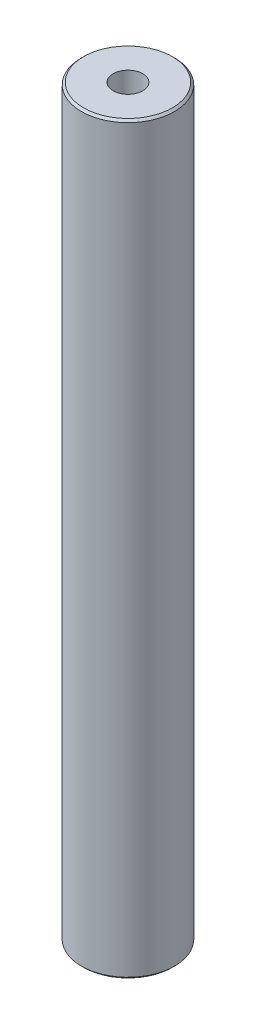
from build123d import *

# Parameters (mm, degrees)
SKETCH1_R           = 37.5
BOSS_EXTRUDE1_DEPTH = 600
SKETCH2_R           = 11.945109462
CUT_EXTRUDE1_DEPTH  = 603.339190158
CHAMFER1_SIZE       = 1.717310467


with BuildPart() as part:
    # Sketch1 → Boss-Extrude1 (new body)
    with BuildSketch(Plane(origin=(0, 0, 0), x_dir=(1, 0, 0), z_dir=(0, 1, 0))):
        Circle(SKETCH1_R)
    extrude(amount=BOSS_EXTRUDE1_DEPTH)

    # Sketch2 → Cut-Extrude1 (cut, through all)
    with BuildSketch(Plane(origin=(0, 0, 0), x_dir=(1, 0, 0), z_dir=(0, 1, 0))):
        Circle(SKETCH2_R)
    extrude(amount=CUT_EXTRUDE1_DEPTH, mode=Mode.SUBTRACT)

    # Chamfer1
    chamfer1_edges = [part.edges().sort_by_distance(p)[0] for p in [
        (-37.5, 600, 0),
        (-37.5, 0, 0),
    ]]
    chamfer(chamfer1_edges, length=CHAMFER1_SIZE)


solid = part.part
